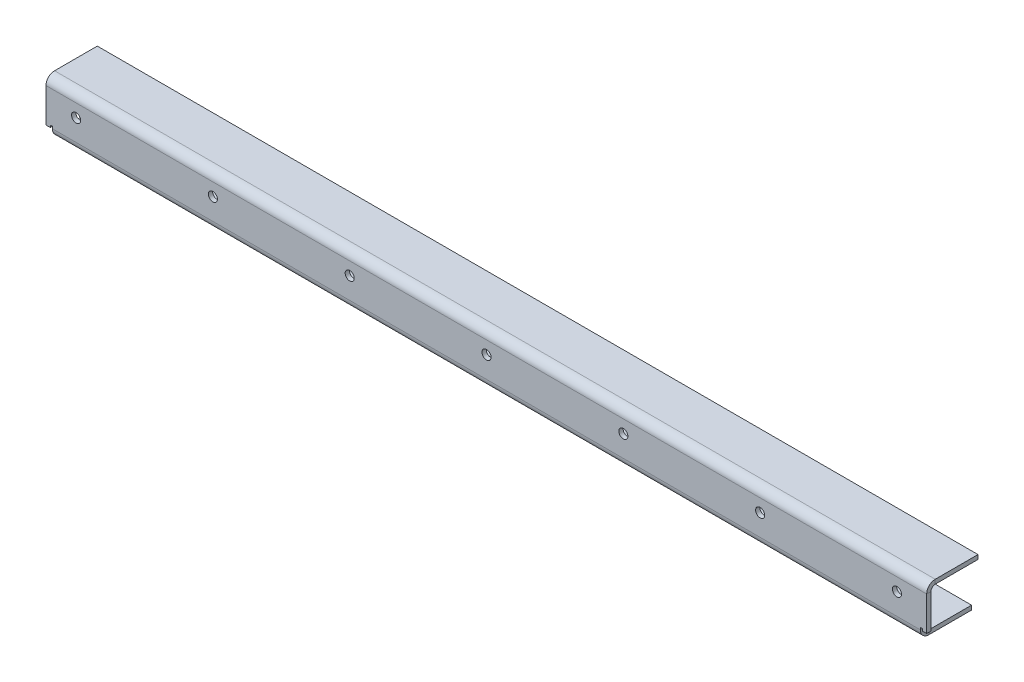
from build123d import *

# Parameters (mm, degrees)
BASE_FLANGE1_DEPTH               = 3.175
EDGE_FLANGE1_STRIP_W             = 19.05
EDGE_FLANGE1_STRIP_H             = 3.175
EDGE_FLANGE1_STRIP_CUT_DEPTH     = 654.05
EDGE_FLANGE1_DEPTH               = 654.05
EDGE_FLANGE2_START               = 4.7625
EDGE_FLANGE2_DEPTH               = 644.525
EDGE_FLANGE2_START_2             = 3.175
EDGE_FLANGE2_2_OUTLINE_W         = 1.5875
EDGE_FLANGE2_2_OUTLINE_H         = 3.175
EDGE_FLANGE2_2_DEPTH             = 1.5875
EDGE_FLANGE2_START_3             = 649.2875
EDGE_FLANGE2_3_OUTLINE_W         = 1.5875
EDGE_FLANGE2_3_OUTLINE_H         = 3.175
EDGE_FLANGE2_3_DEPTH             = 1.5875
EDGE_FLANGE2_4_DEPTH             = 644.525
F_17_64_0_26563_DIAMETER_HOLE1_D = 6.746875
LPATTERN1_COUNT                  = 7
LPATTERN1_PITCH                  = 101.6


# Read off the part's stored shape, not the designer's step: Edge-Flange2
# Sheet-metal steps are written as plain solids
with BuildPart() as part:
    # Sketch2 → Base-Flange1 (new body)
    with BuildSketch(Plane.XY):
        Polygon((4.7625, 0), (4.7625, 6.35), (0, 6.35), (0, 38.1), (654.05, 38.1), (654.05, 6.35), (649.2875, 6.35), (649.2875, 0), align=None)
    extrude(amount=-BASE_FLANGE1_DEPTH)

    # Edge-Flange1 strip (across the edge) → Edge-Flange1 strip cut (cut)
    with BuildSketch(Plane(origin=(0, 38.1, -3.175), x_dir=(0, -1, 0), z_dir=(1, 0, 0))):
        with Locations((-3.175, -1.5875)):
            Rectangle(EDGE_FLANGE1_STRIP_W, EDGE_FLANGE1_STRIP_H)
    extrude(amount=EDGE_FLANGE1_STRIP_CUT_DEPTH, mode=Mode.SUBTRACT)

    # Edge-Flange1 section (across the edge) → Edge-Flange1 (add)
    with BuildSketch(Plane(origin=(0, 38.1, -3.175), x_dir=(0, -1, 0), z_dir=(1, 0, 0))):
        with BuildLine():
            Line((0, 3.175), (0, 34.925))
            Line((0, 34.925), (3.175, 34.925))
            Line((3.175, 34.925), (3.175, 3.175))
            ThreePointArc((3.175, 3.175), (4.10493597, 0.92993597), (6.35, 0))
            Line((6.35, 0), (6.35, -3.175))
            ThreePointArc((6.35, -3.175), (1.859871939, -1.315128061), (0, 3.175))
        make_face()
    extrude(amount=EDGE_FLANGE1_DEPTH)

    # Edge-Flange2 outline → Edge-Flange2 (cut)
    with BuildSketch(Plane.YZ.offset(EDGE_FLANGE2_START)):
        with BuildLine():
            Line((0, -3.175), (0.850738685, -3.175))
            ThreePointArc((0.850738685, -3.175), (3.174999999, -0.850738686), (6.35, 0))
            Line((6.35, 0), (0, 0))
            Line((0, 0), (0, -3.175))
        make_face()
    extrude(amount=EDGE_FLANGE2_DEPTH, mode=Mode.SUBTRACT)

    # Edge-Flange2 2 outline → Edge-Flange2 2 (cut)
    with BuildSketch(Plane.YZ.offset(EDGE_FLANGE2_START_2)):
        with Locations((7.14375, -1.5875)):
            Rectangle(EDGE_FLANGE2_2_OUTLINE_W, EDGE_FLANGE2_2_OUTLINE_H)
    extrude(amount=EDGE_FLANGE2_2_DEPTH, mode=Mode.SUBTRACT)

    # Edge-Flange2 3 outline → Edge-Flange2 3 (cut)
    with BuildSketch(Plane.YZ.offset(EDGE_FLANGE2_START_3)):
        with Locations((7.14375, -1.5875)):
            Rectangle(EDGE_FLANGE2_3_OUTLINE_W, EDGE_FLANGE2_3_OUTLINE_H)
    extrude(amount=EDGE_FLANGE2_3_DEPTH, mode=Mode.SUBTRACT)

    # Edge-Flange2 4 outline → Edge-Flange2 4 (add)
    with BuildSketch(Plane.YZ.offset(EDGE_FLANGE2_START)):
        with BuildLine():
            Line((0, -38.1), (3.175, -38.1))
            Line((3.175, -38.1), (3.175, -6.35))
            ThreePointArc((3.175, -6.35), (4.10493597, -4.10493597), (6.35, -3.175))
            Line((6.35, -3.175), (0.850738685, -3.175))
            ThreePointArc((0.850738685, -3.175), (0.216371003, -4.706499064), (0, -6.35))
            Line((0, -6.35), (0, -38.1))
        make_face()
    extrude(amount=EDGE_FLANGE2_4_DEPTH)

    # 17/64 (0.26563) Diameter Hole1 (through all)
    with Locations(Plane.XY):
        with Locations((22.352, 22.225)):
            f_17_64_0_26563_diameter_hole1 = Hole(F_17_64_0_26563_DIAMETER_HOLE1_D / 2)

    # LPattern1: 17/64 (0.26563) Diameter Hole1 ×7
    with Locations(*[(i * LPATTERN1_PITCH, 0, 0) for i in range(1, LPATTERN1_COUNT)]):
        add(f_17_64_0_26563_diameter_hole1, mode=Mode.SUBTRACT)


solid = part.part
